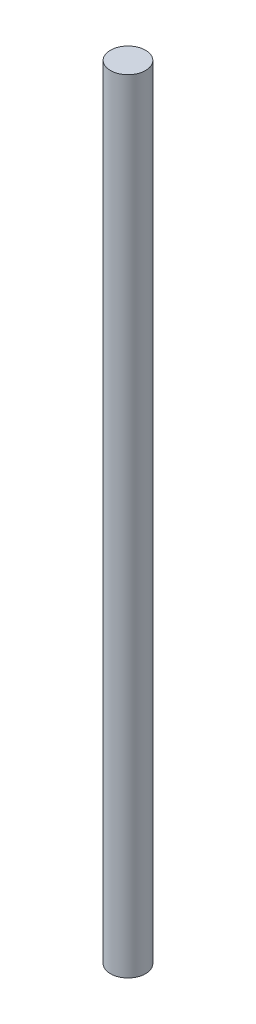
from build123d import *

# Parameters (mm, degrees)
SKETCH1_R           = 1
BOSS_EXTRUDE1_DEPTH = 44.5


with BuildPart() as part:
    # Sketch1 → Boss-Extrude1 (new body)
    with BuildSketch(Plane(origin=(0, 0, 0), x_dir=(1, 0, 0), z_dir=(0, 1, 0))):
        Circle(SKETCH1_R)
    extrude(amount=BOSS_EXTRUDE1_DEPTH)


solid = part.part
